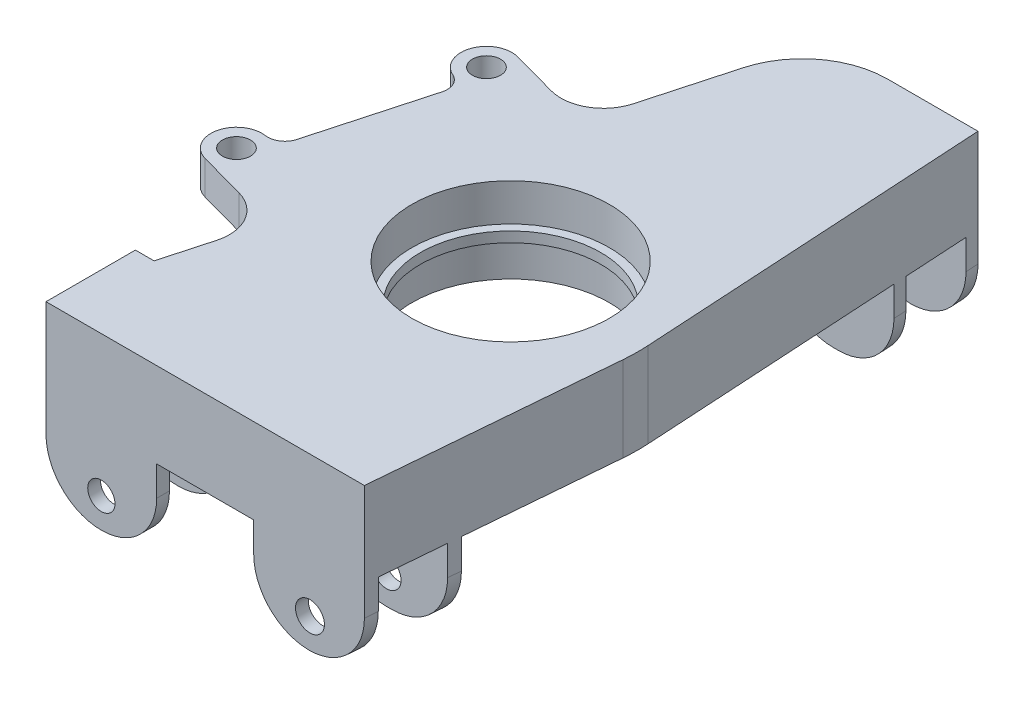
from build123d import *

# Parameters (mm, degrees)
SKETCH1_R                      = 29.464
BASE_DEPTH                     = 25.4
SKETCH2_W                      = 33.02
SKETCH2_H                      = 3.81
A_ARMS_DEPTH                   = 25.4
FILLET_A_ARM_TAB_F_R           = 16.51
FILLET2_R                      = 50.8
BOSS_EXTRUDE3_DEPTH            = 10
FILLET3_R                      = 12.7
SKETCH6_R                      = 4.064
TAB_HOLES_1_DEPTH              = 38.1
SKETCH7_R                      = 4.064
TAB_HOLES_2_DEPTH              = 177.509801452
MID_FEATURE_BEARING_DEPTH      = 1.524
MID_FEATURE_BEARING_DEPTH_BACK = 1.524
SKETCH8_R                      = 29.464
SKETCH8_R_2                    = 26.924
SKETCH11_R                     = 4.318
TAB_HOLES_3_DEPTH              = 50.8


with BuildPart() as part:
    # Sketch1 → Base (new body)
    with BuildSketch(Plane(origin=(0, 0, 0), x_dir=(1, 0, 0), z_dir=(0, 1, 0))):
        with BuildLine():
            Line((-58.88559997, -79.728413598), (36.107103946, -79.728413598))
            Line((36.107103946, -79.728413598), (42.479503863, -4.99030836))
            Line((42.479503863, -4.99030836), (36.107103946, 103.339537331))
            Line((36.107103946, 103.339537331), (9.149946216, 103.339537331))
            ThreePointArc((9.149946216, 103.339537331), (-6.239768533, 98.146384684), (-15.336480298, 84.690457011))
            Line((-15.336480298, 84.690457011), (-53.313910816, -53.058413598))
            Line((-53.313910816, -53.058413598), (-58.88559997, -53.058413598))
            Line((-58.88559997, -53.058413598), (-58.88559997, -79.728413598))
        make_face()
        with Locations(Location((0, 0, 0), (0, 0, 270))):
            Circle(SKETCH1_R, mode=Mode.SUBTRACT)
    extrude(amount=BASE_DEPTH)

    # Sketch2 → A-Arms (add)
    with BuildSketch(Plane(origin=(0, 0, 0), x_dir=(1, 0, 0), z_dir=(0, 1, 0))):
        Polygon((36.107103946, 103.339537331), (36.331223565, 99.529537331), (3.087103946, 99.529537331), (3.087103946, 103.339537331), align=None)
        Polygon((3.087103946, -75.918413598), (36.431956223, -75.918413598), (36.107103946, -79.728413598), (3.087103946, -79.728413598), align=None)
        Polygon((3.087103946, 80.479537331), (3.087103946, 76.669537331), (37.675941275, 76.669537331), (37.451821657, 80.479537331), align=None)
        Polygon((3.087103946, -53.058413598), (38.381069887, -53.058413598), (38.056217609, -56.868413598), (3.087103946, -56.868413598), align=None)
        with Locations((-42.37559997, -54.963413598)):
            Rectangle(SKETCH2_W, SKETCH2_H)
        with Locations((-42.37559997, -77.823413598)):
            Rectangle(SKETCH2_W, SKETCH2_H)
    extrude(amount=-A_ARMS_DEPTH)

    # Fillet a-arm tab f
    # the kernel refuses this fillet: 16.51 mm, written as the material it takes off along each edge
    with BuildSketch(Plane(origin=(39.93846651, -25.4, 34.792630802), x_dir=(-0.9963848042708363, 0, -0.08495482221844149), z_dir=(-0.08495482221844149, 0, 0.9963848042708364)), Plane(origin=(41.887580174, -25.4, 11.932630802), x_dir=(-0.9963848042708365, 0, -0.08495482221843932), z_dir=(-0.08495482221843934, 0, 0.9963848042708366))) as fillet_a_arm_tab_f_piece_1:
        with BuildLine():
            CenterArc((FILLET_A_ARM_TAB_F_R, -FILLET_A_ARM_TAB_F_R), FILLET_A_ARM_TAB_F_R, 90, 90)
            Line((0, -FILLET_A_ARM_TAB_F_R), (0, 0))
            Line((0, 0), (FILLET_A_ARM_TAB_F_R, 0))
        make_face()
    extrude(amount=86.373823872, mode=Mode.SUBTRACT)
    with BuildSketch(Plane(origin=(3.087103946, -25.4, 121.003413598), x_dir=(0, 1, 0), z_dir=(0, 0, -1)), Plane(origin=(3.087103946, -25.4, -121.754537331), x_dir=(1, 0, 0), z_dir=(0, 0, 1)), Plane(origin=(-25.86559997, -25.4, 98.143413598), x_dir=(-1, 0, 0), z_dir=(0, 0, -1)), Plane(origin=(-58.88559997, -25.4, 11.783413598), x_dir=(1, 0, 0), z_dir=(0, 0, 1))) as fillet_a_arm_tab_f_piece_2:
        with BuildLine():
            CenterArc((FILLET_A_ARM_TAB_F_R, FILLET_A_ARM_TAB_F_R), FILLET_A_ARM_TAB_F_R, 180, 90)
            Line((0, FILLET_A_ARM_TAB_F_R), (0, 0))
            Line((0, 0), (FILLET_A_ARM_TAB_F_R, 0))
        make_face()
    extrude(amount=86.36, mode=Mode.SUBTRACT)
    with BuildSketch(Plane(origin=(3.087103946, -25.4, 98.143413598), x_dir=(1, 0, 0), z_dir=(0, 0, -1)), Plane(origin=(3.087103946, -25.4, -58.254537331), x_dir=(1, 0, 0), z_dir=(0, 0, -1)), Plane(origin=(-58.88559997, -25.4, 121.003413598), x_dir=(1, 0, 0), z_dir=(0, 0, -1)), Plane(origin=(-25.86559997, -25.4, 34.643413598), x_dir=(-1, 0, 0), z_dir=(0, 0, 1))) as fillet_a_arm_tab_f_piece_3:
        with BuildLine():
            CenterArc((FILLET_A_ARM_TAB_F_R, -FILLET_A_ARM_TAB_F_R), FILLET_A_ARM_TAB_F_R, 90, 90)
            Line((0, -FILLET_A_ARM_TAB_F_R), (0, 0))
            Line((0, 0), (FILLET_A_ARM_TAB_F_R, 0))
        make_face()
    extrude(amount=86.36, mode=Mode.SUBTRACT)
    with BuildSketch(Plane(origin=(40.099713977, -25.4, -35.465763828), x_dir=(-0.9982743428955775, 0, 0.05872253669931843), z_dir=(-0.05872253669931843, 0, -0.9982743428955776)), Plane(origin=(33.683331244, -25.4, -144.543310834), x_dir=(0, 1, 0), z_dir=(0.05872253669931843, 0, 0.9982743428955776))) as fillet_a_arm_tab_f_piece_4:
        with BuildLine():
            CenterArc((FILLET_A_ARM_TAB_F_R, FILLET_A_ARM_TAB_F_R), FILLET_A_ARM_TAB_F_R, 180, 90)
            Line((0, FILLET_A_ARM_TAB_F_R), (0, 0))
            Line((0, 0), (FILLET_A_ARM_TAB_F_R, 0))
        make_face()
    extrude(amount=86.366586119, mode=Mode.SUBTRACT)

    # Fillet2
    fillet2_edges = [part.edges().sort_by_distance(p)[0] for p in [
        (42.479503863, 12.7, 4.99030836),
    ]]
    fillet(fillet2_edges, radius=FILLET2_R)

    # Sketch3 → Boss-Extrude3 (add)
    with BuildSketch(Plane(origin=(0, 25.4, 0), x_dir=(-1, 0, 0), z_dir=(0, -1, 0))):
        with BuildLine():
            Line((47.666796836, 52.78191811), (25.796089041, 46.75215335))
            Line((25.796089041, 46.75215335), (45.913565896, -26.216440853))
            Line((45.913565896, -26.216440853), (68.231322711, -20.063424462))
            ThreePointArc((68.231322711, -20.063424462), (68.827916005, -17.910119441), (69.356571433, -15.739135906))
            ThreePointArc((69.356571433, -15.739135906), (66.028611601, -10.941366051), (70.726242467, -7.473488245))
            ThreePointArc((70.726242467, -7.473488245), (70.885962372, -5.764957818), (71.004415449, -4.053071275))
            ThreePointArc((71.004415449, -4.053071275), (70.020531637, -4.0078353), (69.039031874, -4.089883254))
            ThreePointArc((69.039031874, -4.089883254), (65.518990894, -3.323443269), (63.392280792, -0.415656673))
            Line((63.392280792, -0.415656673), (54.014483076, 33.598783658))
            ThreePointArc((54.014483076, 33.598783658), (54.320283062, 37.122596493), (56.852004495, 39.592648541))
            ThreePointArc((56.852004495, 39.592648541), (57.672230058, 40.01773376), (58.434985849, 40.538954462))
            ThreePointArc((58.434985849, 40.538954462), (57.439925969, 41.936968234), (56.41142698, 43.310568065))
            ThreePointArc((56.41142698, 43.310568065), (50.594219677, 43.814563519), (50.926596454, 49.644095052))
            ThreePointArc((50.926596454, 49.644095052), (49.321656334, 51.238936528), (47.666796836, 52.78191811))
        make_face()
        with BuildLine():
            Line((51.737082765, 53.904097917), (47.666796836, 52.78191811))
            ThreePointArc((47.666796836, 52.78191811), (49.321656334, 51.238936528), (50.926596454, 49.644095052))
            ThreePointArc((50.926596454, 49.644095052), (55.447559185, 50.395432037), (57.95335867, 46.558169963))
            ThreePointArc((57.95335867, 46.558169963), (57.548301504, 44.760638918), (56.41142698, 43.310568065))
            ThreePointArc((56.41142698, 43.310568065), (57.439925969, 41.936968234), (58.434985849, 40.538954462))
            ThreePointArc((58.434985849, 40.538954462), (60.574765152, 49.972187818), (51.737082765, 53.904097917))
        make_face()
        with BuildLine():
            ThreePointArc((69.356571433, -15.739135906), (68.827916005, -17.910119441), (68.231322711, -20.063424462))
            Line((68.231322711, -20.063424462), (72.188506448, -18.972426984))
            ThreePointArc((72.188506448, -18.972426984), (77.759344227, -11.023625151), (71.004415449, -4.053071275))
            ThreePointArc((71.004415449, -4.053071275), (70.885962372, -5.764957818), (70.726242467, -7.473488245))
            ThreePointArc((70.726242467, -7.473488245), (73.319499224, -8.869245139), (74.354230544, -11.62649903))
            ThreePointArc((74.354230544, -11.62649903), (72.826290125, -14.862637881), (69.356571433, -15.739135906))
        make_face()
    extrude(amount=BOSS_EXTRUDE3_DEPTH)

    # Fillet3
    fillet3_edges = [part.edges().sort_by_distance(p)[0] for p in [
        (-25.796089041, 20.4, -46.75215335),
        (-45.913565896, 20.4, 26.216440853),
    ]]
    fillet(fillet3_edges, radius=FILLET3_R)

    # Sketch6 → Tab Holes 1 (cut)
    with BuildSketch(Plane(origin=(0, 0, -103.339537331), x_dir=(-1, 0, 0), z_dir=(0, 0, -1))):
        with Locations((-19.582846345, -11.893705932)):
            Circle(SKETCH6_R)
    extrude(amount=-TAB_HOLES_1_DEPTH, mode=Mode.SUBTRACT)

    # Sketch7 → Tab Holes 2 (cut, through all)
    with BuildSketch(Plane(origin=(0, 0, 53.058413598), x_dir=(-1, 0, 0), z_dir=(0, 0, -1))):
        with Locations((42.37559997, -16.51)):
            Circle(SKETCH7_R)
    extrude(amount=-TAB_HOLES_2_DEPTH, mode=Mode.SUBTRACT)

    # Sketch8 → mid-feature bearing (add, two sides: drawn at the far end of the back side and taken through both)
    with BuildSketch(Plane(origin=(0, 12.7, 0), x_dir=(1, 0, 0), z_dir=(0, 1, 0)).offset(-MID_FEATURE_BEARING_DEPTH_BACK)):
        with Locations(Location((0, 0, 0), (0, 0, 270))):
            Circle(SKETCH8_R)
        with Locations(Location((0, 0, 0), (0, 0, 270))):
            Circle(SKETCH8_R_2, mode=Mode.SUBTRACT)
    extrude(amount=MID_FEATURE_BEARING_DEPTH + MID_FEATURE_BEARING_DEPTH_BACK)

    # Sketch11 → Tab Holes 3 (cut)
    with BuildSketch(Plane(origin=(0, 0, 79.728413598), x_dir=(-1, 0, 0), z_dir=(0, 0, -1))):
        with Locations(Location((-19.862052779, -16.51, 0), (0, 0, 180))):
            Circle(SKETCH11_R)
    extrude(amount=TAB_HOLES_3_DEPTH, mode=Mode.SUBTRACT)


solid = part.part
